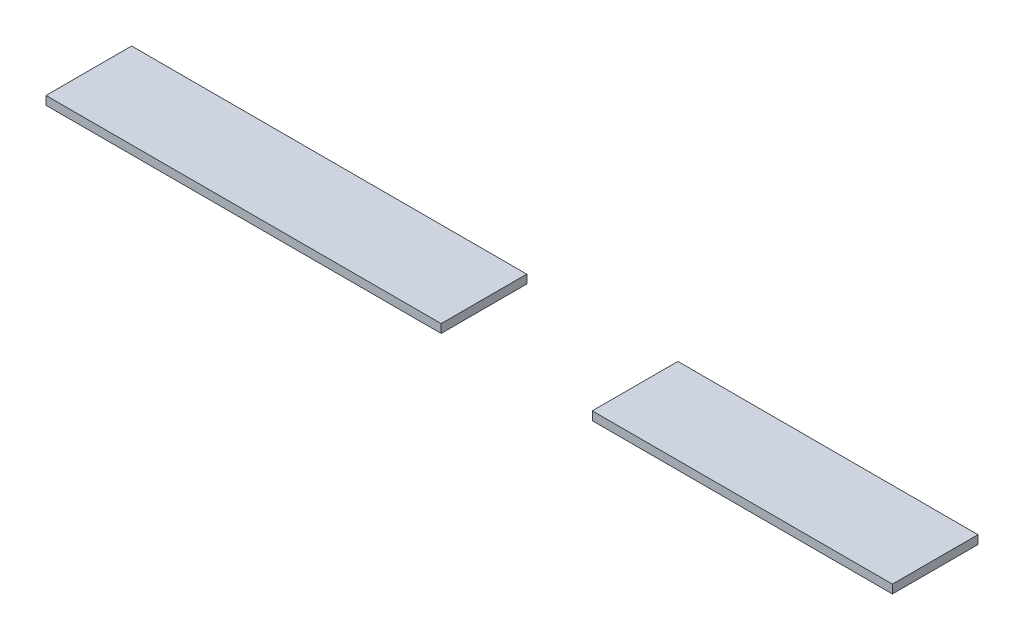
from build123d import *

# Parameters (mm, degrees)
SKETCH1_W           = 197.7
SKETCH1_H           = 20
BOSS_EXTRUDE1_DEPTH = 2
SKETCH3_W           = 25.3
SKETCH3_H           = 20
CUT_EXTRUDE2_DEPTH  = 10
SKETCH4_W           = 5
SKETCH4_H           = 20
CUT_EXTRUDE3_DEPTH  = 10


with BuildPart() as part:
    # Sketch1 → Boss-Extrude1 (new body)
    with BuildSketch(Plane(origin=(0, 0, 0), x_dir=(1, 0, 0), z_dir=(0, 1, 0))):
        with Locations((26.412848541, -2.477865378)):
            Rectangle(SKETCH1_W, SKETCH1_H)
    extrude(amount=BOSS_EXTRUDE1_DEPTH)

    # Sketch3 → Cut-Extrude2 (cut)
    with BuildSketch(Plane(origin=(0, 0, 0), x_dir=(-1, 0, 0), z_dir=(0, -1, 0))):
        with Locations((-37.512848541, -2.477865378)):
            Rectangle(SKETCH3_W, SKETCH3_H)
    extrude(amount=-CUT_EXTRUDE2_DEPTH, mode=Mode.SUBTRACT)


with BuildPart() as cut_extrude2_piece_1:
    # of the separate pieces the step leaves, piece 1, a body of its own (cut_extrude2_pieces)
    add(part.part.solids().sort_by_distance((-72.437151459, 0, -7.522134622))[0])


with BuildPart() as cut_extrude2_piece_2:
    # of the separate pieces the step leaves, piece 2, a body of its own (cut_extrude2_pieces)
    add(part.part.solids().sort_by_distance((50.162848541, 0, -7.522134622))[0])


with BuildPart() as cut_extrude3_tool:
    # Sketch4 → Cut-Extrude3 (new body)
    with BuildSketch(Plane(origin=(0, 0, 0), x_dir=(-1, 0, 0), z_dir=(0, -1, 0))):
        with Locations((-22.362848541, -2.477865378)):
            Rectangle(SKETCH4_W, SKETCH4_H)
        with Locations((-52.662848541, -2.477865378)):
            Rectangle(SKETCH4_W, SKETCH4_H)
    extrude(amount=-CUT_EXTRUDE3_DEPTH)


with BuildPart() as cut_extrude2_piece_1_1:
    add(cut_extrude2_piece_1.part)

    # Cut-Extrude3: cut by cut_extrude3_tool
    add(cut_extrude3_tool.part, mode=Mode.SUBTRACT)


with BuildPart() as cut_extrude2_piece_2_1:
    add(cut_extrude2_piece_2.part)

    # Cut-Extrude3: cut by cut_extrude3_tool
    add(cut_extrude3_tool.part, mode=Mode.SUBTRACT)


solid = Compound([cut_extrude2_piece_1_1.part, cut_extrude2_piece_2_1.part])
